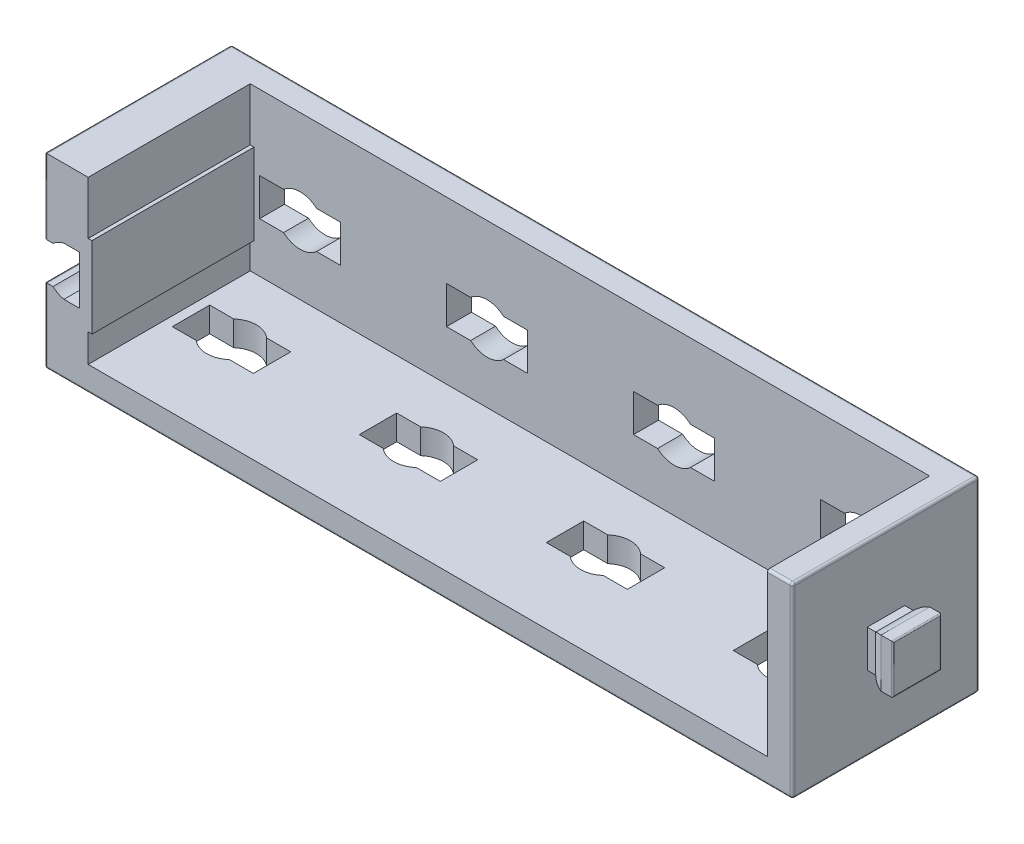
from build123d import *

# Parameters (mm, degrees)
EXTRUDE_1_DEPTH      = 7.5
EXTRUDE_1_DEPTH_BACK = 7.5
SKETCH_1_W           = 60
SKETCH_1_H           = 15
SKETCH_2_W           = 3
SKETCH_2_H           = 3
EXTRUDE_2_DEPTH      = 1
EXTRUDE_3_DEPTH      = 1
EXTRUDE_3_DEPTH_BACK = 4
CUT_EXTRUDE_1_REACH  = 36.667
SKETCH_5_W           = 54.5
SKETCH_5_H           = 13
CUT_EXTRUDE_2_DEPTH  = 13
CUT_EXTRUDE_3_DEPTH  = 9.45
EXTRUDE_4_REACH      = 40.81
SKETCH_7_W           = 0.3
SKETCH_7_H           = 6.5
CUT_EXTRUDE_4_REACH  = 40.082
CUT_EXTRUDE_5_REACH  = 37.798
FILLET_1_R           = 0.1
FILLET_2_R           = 0.2


with BuildPart() as part:
    # 草图1 → 凸台-拉伸1 (new, two sides: drawn at the far end of the back side and taken through both)
    with BuildSketch(Plane.XY.offset(-EXTRUDE_1_DEPTH_BACK)):
        with Locations((0, 7.5)):
            Rectangle(SKETCH_1_W, SKETCH_1_H)
    extrude(amount=EXTRUDE_1_DEPTH + EXTRUDE_1_DEPTH_BACK)

    # 草图2 → 凸台-拉伸2 (add)
    with BuildSketch(Plane(origin=(30, 0, 0), x_dir=(0, 0, -1), z_dir=(1, 0, 0))):
        with Locations((0, 7.5)):
            Rectangle(SKETCH_2_W, SKETCH_2_H)
    extrude(amount=EXTRUDE_2_DEPTH)

    # 草图3 → 凸台-拉伸3 (add, two sides: drawn at the far end of the back side and taken through both)
    with BuildSketch(Plane.XY.offset(1.5).offset(-EXTRUDE_3_DEPTH_BACK)):
        with BuildLine():
            Line((32.5, 9.45), (32.5, 5.55))
            Line((32.5, 5.55), (31.555590279, 5.55))
            ThreePointArc((31.555590279, 5.55), (31.088161527, 5.719957697), (30.677124344, 6))
            Line((30.677124344, 6), (30.677124344, 9))
            ThreePointArc((30.677124344, 9), (31.088161527, 9.280042303), (31.555590279, 9.45))
            Line((31.555590279, 9.45), (32.5, 9.45))
        make_face()
    extrude(amount=EXTRUDE_3_DEPTH + EXTRUDE_3_DEPTH_BACK)

    # 草图4 → 切除-拉伸1 (cut, up to next)
    with BuildSketch(Plane(origin=(0, 9.45, 0), x_dir=(-1, 0, 0), z_dir=(0, 1, 0)), mode=Mode.PRIVATE) as cut_extrude_1_sk1:
        with BuildLine():
            Line((-32.5, -1.95), (-31.555590279, -1.95))
            ThreePointArc((-31.555590279, -1.95), (-31.088161527, -1.780042303), (-30.677124344, -1.5))
            Line((-30.677124344, -1.5), (-30.677124344, -2.5))
            Line((-30.677124344, -2.5), (-32.5, -2.5))
            Line((-32.5, -2.5), (-32.5, -1.95))
        make_face()
    cut_extrude_1_tool1 = extrude(cut_extrude_1_sk1.sketch, amount=-CUT_EXTRUDE_1_REACH, mode=Mode.PRIVATE) & part.part
    # 草图4 → 切除-拉伸1 (cut, up to next)
    with BuildSketch(Plane(origin=(0, 9.45, 0), x_dir=(-1, 0, 0), z_dir=(0, 1, 0)), mode=Mode.PRIVATE) as cut_extrude_1_sk2:
        with BuildLine():
            Line((-30.677124344, 2.5), (-32.5, 2.5))
            Line((-32.5, 2.5), (-32.5, 1.95))
            Line((-32.5, 1.95), (-31.555590279, 1.95))
            ThreePointArc((-31.555590279, 1.95), (-31.088161527, 1.780042303), (-30.677124344, 1.5))
            Line((-30.677124344, 1.5), (-30.677124344, 2.5))
        make_face()
    cut_extrude_1_tool2 = extrude(cut_extrude_1_sk2.sketch, amount=-CUT_EXTRUDE_1_REACH, mode=Mode.PRIVATE) & part.part
    add(cut_extrude_1_tool1.solids().sort_by_distance((31.500125, 9.45, -2.169375))[0], mode=Mode.SUBTRACT)
    add(cut_extrude_1_tool2.solids().sort_by_distance((31.500125, 9.45, 2.169375))[0], mode=Mode.SUBTRACT)

    # 草图5 → 切除-拉伸2 (cut)
    with BuildSketch(Plane.XY.offset(7.5)):
        with Locations((0.75, 8.5)):
            Rectangle(SKETCH_5_W, SKETCH_5_H)
    extrude(amount=-CUT_EXTRUDE_2_DEPTH, mode=Mode.SUBTRACT)

    # 草图6 → 切除-拉伸3 (cut)
    with BuildSketch(Plane.XY.offset(7.5)):
        with BuildLine():
            Line((-27.2, 9.45), (-27.2, 5.55))
            Line((-27.2, 5.55), (-28.444409721, 5.55))
            ThreePointArc((-28.444409721, 5.55), (-28.911838473, 5.719957697), (-29.322875656, 6))
            Line((-29.322875656, 6), (-30, 6))
            Line((-30, 6), (-30, 9))
            Line((-30, 9), (-29.322875656, 9))
            ThreePointArc((-29.322875656, 9), (-28.911838473, 9.280042303), (-28.444409721, 9.45))
            Line((-28.444409721, 9.45), (-27.2, 9.45))
        make_face()
    extrude(amount=-CUT_EXTRUDE_3_DEPTH, mode=Mode.SUBTRACT)

    # 草图7 → 凸台-拉伸4 (add, up to next)
    with BuildSketch(Plane.XY.offset(7.5), mode=Mode.PRIVATE) as extrude_4_sk1:
        with Locations((-26.35, 7.5)):
            Rectangle(SKETCH_7_W, SKETCH_7_H)
    extrude_4_tool1 = extrude(extrude_4_sk1.sketch, amount=-EXTRUDE_4_REACH, mode=Mode.PRIVATE) - part.part
    add(extrude_4_tool1.solids().sort_by_distance((-26.35, 7.5, 7.5))[0])

    # 草图8 → 切除-拉伸4 (cut, up to next)
    with BuildSketch(Plane.XY.offset(-5.5), mode=Mode.PRIVATE) as cut_extrude_4_sk1:
        with BuildLine():
            Line((-21.177124344, 9), (-19.25, 9))
            Line((-19.25, 9), (-19.25, 6))
            Line((-19.25, 6), (-21.177124344, 6))
            ThreePointArc((-21.177124344, 6), (-22.5, 5.5), (-23.822875656, 6))
            Line((-23.822875656, 6), (-25.75, 6))
            Line((-25.75, 6), (-25.75, 9))
            Line((-25.75, 9), (-23.822875656, 9))
            ThreePointArc((-23.822875656, 9), (-22.5, 9.5), (-21.177124344, 9))
        make_face()
    cut_extrude_4_tool1 = extrude(cut_extrude_4_sk1.sketch, amount=-CUT_EXTRUDE_4_REACH, mode=Mode.PRIVATE) & part.part
    # 草图8 → 切除-拉伸4 (cut, up to next)
    with BuildSketch(Plane.XY.offset(-5.5), mode=Mode.PRIVATE) as cut_extrude_4_sk2:
        with BuildLine():
            Line((-10.75, 9), (-8.822875656, 9))
            ThreePointArc((-8.822875656, 9), (-7.5, 9.5), (-6.177124344, 9))
            Line((-6.177124344, 9), (-4.25, 9))
            Line((-4.25, 9), (-4.25, 6))
            Line((-4.25, 6), (-6.177124344, 6))
            ThreePointArc((-6.177124344, 6), (-7.5, 5.5), (-8.822875656, 6))
            Line((-8.822875656, 6), (-10.75, 6))
            Line((-10.75, 6), (-10.75, 9))
        make_face()
    cut_extrude_4_tool2 = extrude(cut_extrude_4_sk2.sketch, amount=-CUT_EXTRUDE_4_REACH, mode=Mode.PRIVATE) & part.part
    # 草图8 → 切除-拉伸4 (cut, up to next)
    with BuildSketch(Plane.XY.offset(-5.5), mode=Mode.PRIVATE) as cut_extrude_4_sk3:
        with BuildLine():
            Line((6.177124344, 6), (4.25, 6))
            Line((4.25, 6), (4.25, 9))
            Line((4.25, 9), (6.177124344, 9))
            ThreePointArc((6.177124344, 9), (7.5, 9.5), (8.822875656, 9))
            Line((8.822875656, 9), (10.75, 9))
            Line((10.75, 9), (10.75, 6))
            Line((10.75, 6), (8.822875656, 6))
            ThreePointArc((8.822875656, 6), (7.5, 5.5), (6.177124344, 6))
        make_face()
    cut_extrude_4_tool3 = extrude(cut_extrude_4_sk3.sketch, amount=-CUT_EXTRUDE_4_REACH, mode=Mode.PRIVATE) & part.part
    # 草图8 → 切除-拉伸4 (cut, up to next)
    with BuildSketch(Plane.XY.offset(-5.5), mode=Mode.PRIVATE) as cut_extrude_4_sk4:
        with BuildLine():
            Line((21.177124344, 6), (19.25, 6))
            Line((19.25, 6), (19.25, 9))
            Line((19.25, 9), (21.177124344, 9))
            ThreePointArc((21.177124344, 9), (22.5, 9.5), (23.822875656, 9))
            Line((23.822875656, 9), (25.75, 9))
            Line((25.75, 9), (25.75, 6))
            Line((25.75, 6), (23.822875656, 6))
            ThreePointArc((23.822875656, 6), (22.5, 5.5), (21.177124344, 6))
        make_face()
    cut_extrude_4_tool4 = extrude(cut_extrude_4_sk4.sketch, amount=-CUT_EXTRUDE_4_REACH, mode=Mode.PRIVATE) & part.part
    add(cut_extrude_4_tool1.solids().sort_by_distance((-22.5, 7.5, -5.5))[0], mode=Mode.SUBTRACT)
    add(cut_extrude_4_tool2.solids().sort_by_distance((-7.5, 7.5, -5.5))[0], mode=Mode.SUBTRACT)
    add(cut_extrude_4_tool3.solids().sort_by_distance((7.5, 7.5, -5.5))[0], mode=Mode.SUBTRACT)
    add(cut_extrude_4_tool4.solids().sort_by_distance((22.5, 7.5, -5.5))[0], mode=Mode.SUBTRACT)

    # 草图9 → 切除-拉伸5 (cut, up to next)
    with BuildSketch(Plane(origin=(0, 2, 0), x_dir=(-1, 0, 0), z_dir=(0, 1, 0)), mode=Mode.PRIVATE) as cut_extrude_5_sk1:
        with BuildLine():
            Line((21.177124344, -1.5), (19.25, -1.5))
            Line((19.25, -1.5), (19.25, 1.5))
            Line((19.25, 1.5), (21.177124344, 1.5))
            ThreePointArc((21.177124344, 1.5), (22.5, 2), (23.822875656, 1.5))
            Line((23.822875656, 1.5), (25.75, 1.5))
            Line((25.75, 1.5), (25.75, -1.5))
            Line((25.75, -1.5), (23.822875656, -1.5))
            ThreePointArc((23.822875656, -1.5), (22.5, -2), (21.177124344, -1.5))
        make_face()
    cut_extrude_5_tool1 = extrude(cut_extrude_5_sk1.sketch, amount=-CUT_EXTRUDE_5_REACH, mode=Mode.PRIVATE) & part.part
    # 草图9 → 切除-拉伸5 (cut, up to next)
    with BuildSketch(Plane(origin=(0, 2, 0), x_dir=(-1, 0, 0), z_dir=(0, 1, 0)), mode=Mode.PRIVATE) as cut_extrude_5_sk2:
        with BuildLine():
            Line((10.75, -1.5), (8.822875656, -1.5))
            ThreePointArc((8.822875656, -1.5), (7.5, -2), (6.177124344, -1.5))
            Line((6.177124344, -1.5), (4.25, -1.5))
            Line((4.25, -1.5), (4.25, 1.5))
            Line((4.25, 1.5), (6.177124344, 1.5))
            ThreePointArc((6.177124344, 1.5), (7.5, 2), (8.822875656, 1.5))
            Line((8.822875656, 1.5), (10.75, 1.5))
            Line((10.75, 1.5), (10.75, -1.5))
        make_face()
    cut_extrude_5_tool2 = extrude(cut_extrude_5_sk2.sketch, amount=-CUT_EXTRUDE_5_REACH, mode=Mode.PRIVATE) & part.part
    # 草图9 → 切除-拉伸5 (cut, up to next)
    with BuildSketch(Plane(origin=(0, 2, 0), x_dir=(-1, 0, 0), z_dir=(0, 1, 0)), mode=Mode.PRIVATE) as cut_extrude_5_sk3:
        with BuildLine():
            Line((-6.177124344, 1.5), (-4.25, 1.5))
            Line((-4.25, 1.5), (-4.25, -1.5))
            Line((-4.25, -1.5), (-6.177124344, -1.5))
            ThreePointArc((-6.177124344, -1.5), (-7.5, -2), (-8.822875656, -1.5))
            Line((-8.822875656, -1.5), (-10.75, -1.5))
            Line((-10.75, -1.5), (-10.75, 1.5))
            Line((-10.75, 1.5), (-8.822875656, 1.5))
            ThreePointArc((-8.822875656, 1.5), (-7.5, 2), (-6.177124344, 1.5))
        make_face()
    cut_extrude_5_tool3 = extrude(cut_extrude_5_sk3.sketch, amount=-CUT_EXTRUDE_5_REACH, mode=Mode.PRIVATE) & part.part
    # 草图9 → 切除-拉伸5 (cut, up to next)
    with BuildSketch(Plane(origin=(0, 2, 0), x_dir=(-1, 0, 0), z_dir=(0, 1, 0)), mode=Mode.PRIVATE) as cut_extrude_5_sk4:
        with BuildLine():
            Line((-21.177124344, 1.5), (-19.25, 1.5))
            Line((-19.25, 1.5), (-19.25, -1.5))
            Line((-19.25, -1.5), (-21.177124344, -1.5))
            ThreePointArc((-21.177124344, -1.5), (-22.5, -2), (-23.822875656, -1.5))
            Line((-23.822875656, -1.5), (-25.75, -1.5))
            Line((-25.75, -1.5), (-25.75, 1.5))
            Line((-25.75, 1.5), (-23.822875656, 1.5))
            ThreePointArc((-23.822875656, 1.5), (-22.5, 2), (-21.177124344, 1.5))
        make_face()
    cut_extrude_5_tool4 = extrude(cut_extrude_5_sk4.sketch, amount=-CUT_EXTRUDE_5_REACH, mode=Mode.PRIVATE) & part.part
    add(cut_extrude_5_tool1.solids().sort_by_distance((-22.5, 2, 0))[0], mode=Mode.SUBTRACT)
    add(cut_extrude_5_tool2.solids().sort_by_distance((-7.5, 2, 0))[0], mode=Mode.SUBTRACT)
    add(cut_extrude_5_tool3.solids().sort_by_distance((7.5, 2, 0))[0], mode=Mode.SUBTRACT)
    add(cut_extrude_5_tool4.solids().sort_by_distance((22.5, 2, 0))[0], mode=Mode.SUBTRACT)

    # 圆角1
    fillet_1_edges = [part.edges().sort_by_distance(p)[0] for p in [
        (32.5, 9.45, 0),
        (32.5, 7.5, -1.95),
        (32.5, 5.55, 0),
        (32.5, 7.5, 1.95),
    ]]
    fillet(fillet_1_edges, radius=FILLET_1_R)

    # 圆角2
    fillet_2_edges = [part.edges().sort_by_distance(p)[0] for p in [
        (-30, 3, 7.5),
        (-30, 0, 0),
        (-30, 7.5, -7.5),
        (-30, 15, 0),
        (-30, 12, 7.5),
        (-30, 9, 2.775),
        (-30, 7.5, -1.95),
        (-30, 6, 2.775),
        (0, 0, -7.5),
        (0, 0, 7.5),
        (0, 15, -7.5),
        (30, 0, 0),
        (30, 7.5, -7.5),
        (30, 15, 0),
        (29, 15, 7.5),
        (30, 7.5, 7.5),
    ]]
    fillet(fillet_2_edges, radius=FILLET_2_R)


solid = part.part
